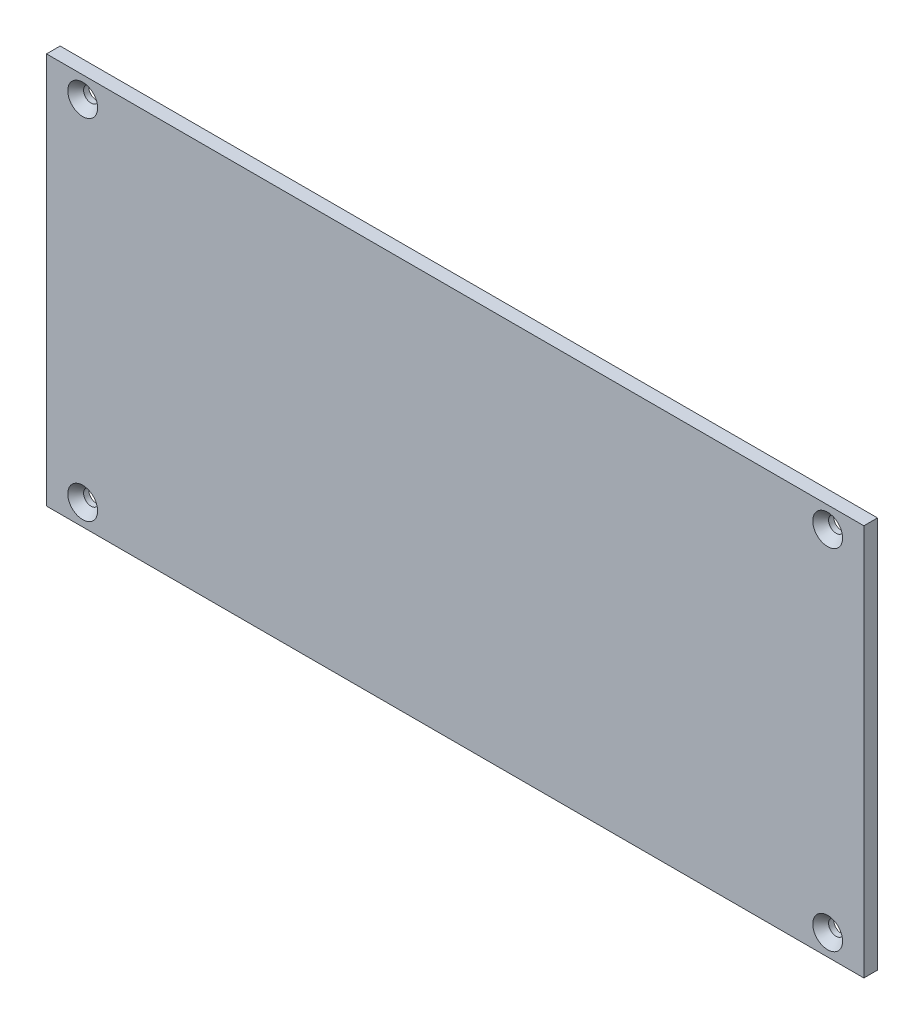
from build123d import *

# Parameters (mm, degrees)
SKETCH1_W                                     = 96
SKETCH1_H                                     = 46
BOSS_EXTRUDE1_DEPTH                           = 1.6002
CSK_FOR_0_FLAT_HEAD_SOCKET_CAP_SCREW1_A_COUNT = 2
CSK_FOR_0_FLAT_HEAD_SOCKET_CAP_SCREW1_A_PITCH = 41
CSK_FOR_0_FLAT_HEAD_SOCKET_CAP_SCRE_2_COUNT   = 2
CSK_FOR_0_FLAT_HEAD_SOCKET_CAP_SCRE_2_PITCH   = 96.629446858
CSK_FOR_0_FLAT_HEAD_SOCKET_CAP_SCRE_3_COUNT   = 2
CSK_FOR_0_FLAT_HEAD_SOCKET_CAP_SCRE_3_PITCH   = 87.5


with BuildPart() as part:
    # Sketch1 → Boss-Extrude1 (new body)
    with BuildSketch(Plane.XY):
        with Locations((48, 23)):
            Rectangle(SKETCH1_W, SKETCH1_H)
    extrude(amount=BOSS_EXTRUDE1_DEPTH)

    # Sketch7 → CSK for #0 Flat Head Socket Cap Screw1 (revolve, cut)
    with BuildSketch(Plane(origin=(4.25, 43.5, 1.6002), x_dir=(0, -1, 0), z_dir=(1, 0, 0))):
        Polygon((0, 0), (0, 1.6002), (0.889, 1.6002), (0.889, 0.993458156), (1.7526, 0), align=None)
    csk_for_0_flat_head_socket_cap_screw1 = revolve(axis=Axis((4.25, 43.5, 7.9502), (0, 0, -1)), mode=Mode.SUBTRACT)

    # CSK for #0 Flat Head Socket Cap Screw1 a: CSK for #0 Flat Head Socket Cap Screw1 ×2
    with Locations(*[(0, -i * CSK_FOR_0_FLAT_HEAD_SOCKET_CAP_SCREW1_A_PITCH, 0) for i in range(1, CSK_FOR_0_FLAT_HEAD_SOCKET_CAP_SCREW1_A_COUNT)]):
        add(csk_for_0_flat_head_socket_cap_screw1, mode=Mode.SUBTRACT)

    # CSK for _0 Flat Head Socket Cap Scre 2: CSK for #0 Flat Head Socket Cap Screw1 ×2
    with Locations(*[Vector(0.9055210688411901, -0.424301300828443, 0) * (i * CSK_FOR_0_FLAT_HEAD_SOCKET_CAP_SCRE_2_PITCH) for i in range(1, CSK_FOR_0_FLAT_HEAD_SOCKET_CAP_SCRE_2_COUNT)]):
        add(csk_for_0_flat_head_socket_cap_screw1, mode=Mode.SUBTRACT)

    # CSK for _0 Flat Head Socket Cap Scre 3: CSK for #0 Flat Head Socket Cap Screw1 ×2
    with Locations(*[(i * CSK_FOR_0_FLAT_HEAD_SOCKET_CAP_SCRE_3_PITCH, 0, 0) for i in range(1, CSK_FOR_0_FLAT_HEAD_SOCKET_CAP_SCRE_3_COUNT)]):
        add(csk_for_0_flat_head_socket_cap_screw1, mode=Mode.SUBTRACT)


solid = part.part
